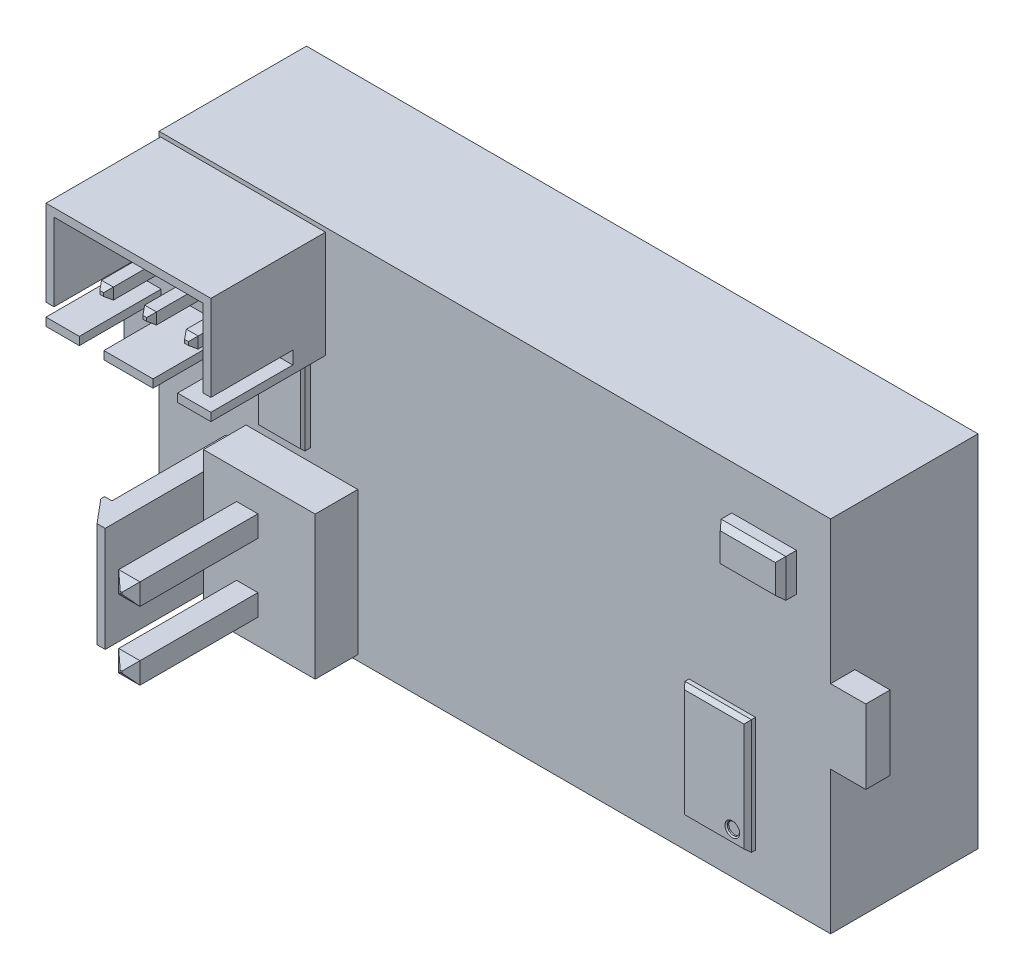
from build123d import *
from OCP.BRepFilletAPI import BRepFilletAPI_MakeChamfer

# Parameters (mm, degrees)
RESSALTO_EXTRUS_O1_DEPTH  = 9
ESBO_O2_W                 = 7.71
ESBO_O2_H                 = 4.52
CORTE_EXTRUS_O1_DEPTH     = 2.15
ESBO_O3_W                 = 7.71
ESBO_O3_H                 = 4.52
CORTE_EXTRUS_O2_DEPTH     = 2.15
RESSALTO_EXTRUS_O2_DEPTH  = 45.3
RESSALTO_EXTRUS_O4_DEPTH  = 2.6
ESBO_O11_W                = 1.3
ESBO_O11_H                = 1.3
RESSALTO_EXTRUS_O5_DEPTH  = 7.7
CHANFRO1_SIZE             = 0.5
CHANFRO1_SIZE2            = 0.595876796
ESBO_O12_W                = 1.247641749
ESBO_O12_H                = 6.404560975
RESSALTO_EXTRUS_O6_DEPTH  = 6
ESBO_O13_W                = 1.65918813
ESBO_O13_H                = 6.404560975
RESSALTO_EXTRUS_O7_DEPTH  = 0.45
CHANFRO2_SIZE             = 1.2
CHANFRO2_SIZE2            = 1.430104311
ESBO_O14_W                = 10.066468689
ESBO_O14_H                = 6.518451036
RESSALTO_EXTRUS_O8_DEPTH  = 2
ESBO_O15_W                = 10.066468689
ESBO_O15_H                = 6.518451036
ESBO_O15_W_2              = 9.090887041
ESBO_O15_H_2              = 5.530006866
RESSALTO_EXTRUS_O9_DEPTH  = 5
ESBO_O16_W                = 0.487790824
ESBO_O16_H                = 0.786498023
CORTE_EXTRUS_O3_DEPTH     = 5
ESBO_O17_W                = 1.5
ESBO_O17_H                = 0.494222085
CORTE_EXTRUS_O4_DEPTH     = 5
ESBO_O19_W                = 0.72
ESBO_O19_H                = 0.693974063
ESBO_O19_W_2              = 0.722477419
ESBO_O19_H_2              = 0.691394518
RESSALTO_EXTRUS_O10_DEPTH = 4
CHANFRO3_SIZE             = 0.35
CHANFRO3_SIZE2            = 0.245072638
ESBO_O20_W                = 4.059987293
ESBO_O20_H                = 7.020394696
RESSALTO_EXTRUS_O13_DEPTH = 0.5
CHANFRO5_SIZE             = 0.25
CHANFRO5_SIZE2            = 0.209774908
ESBO_O21_R                = 0.36689919
CORTE_EXTRUS_O5_DEPTH     = 0.15
CHANFRO6_SIZE             = 0.08
CHANFRO6_SIZE2            = 0.06712797
ESBO_O22_W                = 3.950865536
ESBO_O22_H                = 2.32199992
RESSALTO_EXTRUS_O14_DEPTH = 1
CHANFRO7_SIZE             = 0.35
CHANFRO7_SIZE2            = 0.293684871
ESBO_O23_W                = 2.819161313
ESBO_O23_H                = 4.881962274
RESSALTO_EXTRUS_O15_DEPTH = 0.5
CHANFRO8_SIZE             = 0.15
CHANFRO8_SIZE2            = 0.125864945
ESBO_O24_R                = 0.225
CORTE_EXTRUS_O6_DEPTH     = 0.1
FILETE1_R                 = 0.04
RESSALTO_EXTRUS_O16_DEPTH = 0.1
ESBO_O27_R                = 0.44
RESSALTO_EXTRUS_O17_DEPTH = 0.1
RESSALTO_EXTRUS_O18_DEPTH = 0.1
RESSALTO_EXTRUS_O19_DEPTH = 0.1
RESSALTO_EXTRUS_O20_DEPTH = 0.1
RESSALTO_EXTRUS_O22_DEPTH = 0.1
RESSALTO_EXTRUS_O23_DEPTH = 0.1
RESSALTO_EXTRUS_O24_DEPTH = 0.1
RESSALTO_EXTRUS_O25_DEPTH = 0.1


# Read off the part's stored shape, not the designer's step: Ressalto-extrusão16
with BuildPart() as part:
    # Esboço1 → Ressalto-extrusão1 (new body)
    with BuildSketch(Plane.XY):
        Polygon((20.5, 2.26), (20.5, 10.97), (-20.5, 10.97), (-20.5, 2.26), (-22.65, 2.26), (-22.65, -2.26), (-20.5, -2.26), (-20.5, -10.97), (20.5, -10.97), (20.5, -2.26), (22.65, -2.26), (22.65, 2.26), align=None)
    extrude(amount=RESSALTO_EXTRUS_O1_DEPTH)

    # Esboço2 → Corte-extrusão1 (cut)
    with BuildSketch(Plane(origin=(22.65, 0, 0), x_dir=(0, 0, -1), z_dir=(1, 0, 0))):
        with Locations((-3.855, 0)):
            Rectangle(ESBO_O2_W, ESBO_O2_H)
    extrude(amount=-CORTE_EXTRUS_O1_DEPTH, mode=Mode.SUBTRACT)

    # Esboço3 → Corte-extrusão2 (cut)
    with BuildSketch(Plane.ZY.offset(22.65)):
        with Locations((3.855, 0)):
            Rectangle(ESBO_O3_W, ESBO_O3_H)
    extrude(amount=-CORTE_EXTRUS_O2_DEPTH, mode=Mode.SUBTRACT)

    # Esboço4 → Ressalto-extrusão2 (add)
    with BuildSketch(Plane(origin=(22.65, 0, 0), x_dir=(0, 0, -1), z_dir=(1, 0, 0))):
        Polygon((-7.71, 2.26), (-7.514247248, 2.26), (-7.514247248, -2.254762837), (-7.514247248, -2.26), (-7.71, -2.26), align=None)
    extrude(amount=-RESSALTO_EXTRUS_O2_DEPTH)

    # Esboço9 → Ressalto-extrusão4 (add)
    with BuildSketch(Plane.XY.offset(9)):
        Polygon((-15.187431862, -3.070040694), (-15.187431862, -1.905575063), (-8.366990305, -1.905575063), (-8.366990305, -10.6390673), (-15.187431862, -10.6390673), (-15.187431862, -9.474601669), (-16.435073611, -9.474601669), (-16.435073611, -3.070040694), align=None)
    extrude(amount=RESSALTO_EXTRUS_O4_DEPTH)

    # Esboço11 → Ressalto-extrusão5 (add)
    with BuildSketch(Plane.XY.offset(11.6)):
        with Locations((-12.515679455, -4.290464301)):
            Rectangle(ESBO_O11_W, ESBO_O11_H)
        with Locations((-12.515679455, -8.45811136)):
            Rectangle(ESBO_O11_W, ESBO_O11_H)
    extrude(amount=RESSALTO_EXTRUS_O5_DEPTH)

    # Chanfro1: one chamfer whose edges measure the first distance from different faces: ONE call of the kernel's chamfer builder (chamfer() names one face for all edges)
    chanfro1_edges_1 = [part.edges().sort_by_distance(p)[0] for p in [
        (-11.865679455, -4.290464301, 19.3),
    ]]
    chanfro1_side_1 = [part.faces().sort_by_distance(p)[0] for p in [
        (-11.865679455, -4.290464301, 15.45),
    ]]
    chanfro1_edges_2 = [part.edges().sort_by_distance(p)[0] for p in [
        (-12.515679455, -3.640464301, 19.3),
    ]]
    chanfro1_side_2 = [part.faces().sort_by_distance(p)[0] for p in [
        (-12.515679455, -3.640464301, 15.45),
    ]]
    chanfro1_edges_3 = [part.edges().sort_by_distance(p)[0] for p in [
        (-13.165679455, -4.290464301, 19.3),
    ]]
    chanfro1_side_3 = [part.faces().sort_by_distance(p)[0] for p in [
        (-13.165679455, -4.290464301, 15.45),
    ]]
    chanfro1_edges_4 = [part.edges().sort_by_distance(p)[0] for p in [
        (-12.515679455, -4.940464301, 19.3),
    ]]
    chanfro1_side_4 = [part.faces().sort_by_distance(p)[0] for p in [
        (-12.515679455, -4.940464301, 15.45),
    ]]
    chanfro1_edges_5 = [part.edges().sort_by_distance(p)[0] for p in [
        (-11.865679455, -8.45811136, 19.3),
    ]]
    chanfro1_side_5 = [part.faces().sort_by_distance(p)[0] for p in [
        (-11.865679455, -8.45811136, 15.45),
    ]]
    chanfro1_edges_6 = [part.edges().sort_by_distance(p)[0] for p in [
        (-12.515679455, -7.80811136, 19.3),
    ]]
    chanfro1_side_6 = [part.faces().sort_by_distance(p)[0] for p in [
        (-12.515679455, -7.80811136, 15.45),
    ]]
    chanfro1_edges_7 = [part.edges().sort_by_distance(p)[0] for p in [
        (-13.165679455, -8.45811136, 19.3),
    ]]
    chanfro1_side_7 = [part.faces().sort_by_distance(p)[0] for p in [
        (-13.165679455, -8.45811136, 15.45),
    ]]
    chanfro1_edges_8 = [part.edges().sort_by_distance(p)[0] for p in [
        (-12.515679455, -9.10811136, 19.3),
    ]]
    chanfro1_side_8 = [part.faces().sort_by_distance(p)[0] for p in [
        (-12.515679455, -9.10811136, 15.45),
    ]]
    chanfro1 = BRepFilletAPI_MakeChamfer(part.part.solid().wrapped)
    for e in chanfro1_edges_1:
        chanfro1.Add(CHANFRO1_SIZE, CHANFRO1_SIZE2, e.wrapped, chanfro1_side_1[0].wrapped)  # the first distance lies on this face
    for e in chanfro1_edges_2:
        chanfro1.Add(CHANFRO1_SIZE, CHANFRO1_SIZE2, e.wrapped, chanfro1_side_2[0].wrapped)  # the first distance lies on this face
    for e in chanfro1_edges_3:
        chanfro1.Add(CHANFRO1_SIZE, CHANFRO1_SIZE2, e.wrapped, chanfro1_side_3[0].wrapped)  # the first distance lies on this face
    for e in chanfro1_edges_4:
        chanfro1.Add(CHANFRO1_SIZE, CHANFRO1_SIZE2, e.wrapped, chanfro1_side_4[0].wrapped)  # the first distance lies on this face
    for e in chanfro1_edges_5:
        chanfro1.Add(CHANFRO1_SIZE, CHANFRO1_SIZE2, e.wrapped, chanfro1_side_5[0].wrapped)  # the first distance lies on this face
    for e in chanfro1_edges_6:
        chanfro1.Add(CHANFRO1_SIZE, CHANFRO1_SIZE2, e.wrapped, chanfro1_side_6[0].wrapped)  # the first distance lies on this face
    for e in chanfro1_edges_7:
        chanfro1.Add(CHANFRO1_SIZE, CHANFRO1_SIZE2, e.wrapped, chanfro1_side_7[0].wrapped)  # the first distance lies on this face
    for e in chanfro1_edges_8:
        chanfro1.Add(CHANFRO1_SIZE, CHANFRO1_SIZE2, e.wrapped, chanfro1_side_8[0].wrapped)  # the first distance lies on this face
    add(Compound.cast(chanfro1.Shape()), mode=Mode.REPLACE)

    # Esboço12 → Ressalto-extrusão6 (add)
    with BuildSketch(Plane.XY.offset(11.6)):
        with Locations((-15.811252737, -6.272321182)):
            Rectangle(ESBO_O12_W, ESBO_O12_H)
    extrude(amount=RESSALTO_EXTRUS_O6_DEPTH)

    # Esboço13 → Ressalto-extrusão7 (add)
    with BuildSketch(Plane.ZY.offset(16.435073611)):
        with Locations((16.770405935, -6.272321182)):
            Rectangle(ESBO_O13_W, ESBO_O13_H)
    extrude(amount=RESSALTO_EXTRUS_O7_DEPTH)

    # Chanfro2
    chanfro2_edges = [part.edges().sort_by_distance(p)[0] for p in [
        (-16.885073611, -6.272321182, 17.6),
    ]]
    chanfro2_side = [part.faces().sort_by_distance(p)[0] for p in [
        (-16.036252737, -6.272321182, 17.6),
    ]]
    chamfer(chanfro2_edges, length=CHANFRO2_SIZE, length2=CHANFRO2_SIZE2, reference=chanfro2_side[0])

    # Esboço14 → Ressalto-extrusão8 (add)
    with BuildSketch(Plane.XY.offset(9)):
        with Locations((-15.368835147, 7.455571209)):
            Rectangle(ESBO_O14_W, ESBO_O14_H)
    extrude(amount=RESSALTO_EXTRUS_O8_DEPTH)

    # Esboço15 → Ressalto-extrusão9 (add)
    with BuildSketch(Plane.XY.offset(11)):
        with Locations((-15.368835147, 7.455571209)):
            Rectangle(ESBO_O15_W, ESBO_O15_H)
        with Locations((-15.368835147, 7.455571209)):
            Rectangle(ESBO_O15_W_2, ESBO_O15_H_2, mode=Mode.SUBTRACT)
    extrude(amount=RESSALTO_EXTRUS_O9_DEPTH)

    # Esboço16 → Corte-extrusão3 (cut)
    with BuildSketch(Plane.XY.offset(11)):
        with Locations((-20.158174079, 5.083816787)):
            Rectangle(ESBO_O16_W, ESBO_O16_H)
        with Locations((-10.579496214, 5.083816787)):
            Rectangle(ESBO_O16_W, ESBO_O16_H)
    extrude(amount=CORTE_EXTRUS_O3_DEPTH, mode=Mode.SUBTRACT)

    # Esboço17 → Corte-extrusão4 (cut)
    with BuildSketch(Plane.XY.offset(11)):
        with Locations((-13.118835147, 4.443456733)):
            Rectangle(ESBO_O17_W, ESBO_O17_H)
        with Locations((-17.618835147, 4.443456733)):
            Rectangle(ESBO_O17_W, ESBO_O17_H)
    extrude(amount=CORTE_EXTRUS_O4_DEPTH, mode=Mode.SUBTRACT)

    # Esboço19 → Ressalto-extrusão10 (add)
    with BuildSketch(Plane.XY.offset(11)):
        with Locations((-15.368835147, 6.639450457)):
            Rectangle(ESBO_O19_W, ESBO_O19_H)
        with Locations((-12.823391626, 6.639450457)):
            Rectangle(ESBO_O19_W, ESBO_O19_H)
        with Locations((-18.001110378, 6.639450457)):
            Rectangle(ESBO_O19_W_2, ESBO_O19_H_2)
    extrude(amount=RESSALTO_EXTRUS_O10_DEPTH)

    # Chanfro3: one chamfer whose edges measure the first distance from different faces: ONE call of the kernel's chamfer builder (chamfer() names one face for all edges)
    chanfro3_edges_1 = [part.edges().sort_by_distance(p)[0] for p in [
        (-15.008835147, 6.639450457, 15),
    ]]
    chanfro3_side_1 = [part.faces().sort_by_distance(p)[0] for p in [
        (-15.008835147, 6.639450457, 13),
    ]]
    chanfro3_edges_2 = [part.edges().sort_by_distance(p)[0] for p in [
        (-15.368835147, 6.986437488, 15),
    ]]
    chanfro3_side_2 = [part.faces().sort_by_distance(p)[0] for p in [
        (-15.368835147, 6.986437488, 13),
    ]]
    chanfro3_edges_3 = [part.edges().sort_by_distance(p)[0] for p in [
        (-15.728835147, 6.639450457, 15),
    ]]
    chanfro3_side_3 = [part.faces().sort_by_distance(p)[0] for p in [
        (-15.728835147, 6.639450457, 13),
    ]]
    chanfro3_edges_4 = [part.edges().sort_by_distance(p)[0] for p in [
        (-15.368835147, 6.292463425, 15),
    ]]
    chanfro3_side_4 = [part.faces().sort_by_distance(p)[0] for p in [
        (-15.368835147, 6.292463425, 13),
    ]]
    chanfro3_edges_5 = [part.edges().sort_by_distance(p)[0] for p in [
        (-12.463391626, 6.639450457, 15),
    ]]
    chanfro3_side_5 = [part.faces().sort_by_distance(p)[0] for p in [
        (-12.463391626, 6.639450457, 13),
    ]]
    chanfro3_edges_6 = [part.edges().sort_by_distance(p)[0] for p in [
        (-12.823391626, 6.986437488, 15),
    ]]
    chanfro3_side_6 = [part.faces().sort_by_distance(p)[0] for p in [
        (-12.823391626, 6.986437488, 13),
    ]]
    chanfro3_edges_7 = [part.edges().sort_by_distance(p)[0] for p in [
        (-13.183391626, 6.639450457, 15),
    ]]
    chanfro3_side_7 = [part.faces().sort_by_distance(p)[0] for p in [
        (-13.183391626, 6.639450457, 13),
    ]]
    chanfro3_edges_8 = [part.edges().sort_by_distance(p)[0] for p in [
        (-12.823391626, 6.292463425, 15),
    ]]
    chanfro3_side_8 = [part.faces().sort_by_distance(p)[0] for p in [
        (-12.823391626, 6.292463425, 13),
    ]]
    chanfro3_edges_9 = [part.edges().sort_by_distance(p)[0] for p in [
        (-17.639871668, 6.639450457, 15),
    ]]
    chanfro3_side_9 = [part.faces().sort_by_distance(p)[0] for p in [
        (-17.639871668, 6.639450457, 13),
    ]]
    chanfro3_edges_10 = [part.edges().sort_by_distance(p)[0] for p in [
        (-18.001110377, 6.985147716, 15),
    ]]
    chanfro3_side_10 = [part.faces().sort_by_distance(p)[0] for p in [
        (-18.001110377, 6.985147716, 13),
    ]]
    chanfro3_edges_11 = [part.edges().sort_by_distance(p)[0] for p in [
        (-18.362349087, 6.639450457, 15),
    ]]
    chanfro3_side_11 = [part.faces().sort_by_distance(p)[0] for p in [
        (-18.362349087, 6.639450457, 13),
    ]]
    chanfro3_edges_12 = [part.edges().sort_by_distance(p)[0] for p in [
        (-18.001110377, 6.293753198, 15),
    ]]
    chanfro3_side_12 = [part.faces().sort_by_distance(p)[0] for p in [
        (-18.001110377, 6.293753198, 13),
    ]]
    chanfro3 = BRepFilletAPI_MakeChamfer(part.part.solid().wrapped)
    for e in chanfro3_edges_1:
        chanfro3.Add(CHANFRO3_SIZE, CHANFRO3_SIZE2, e.wrapped, chanfro3_side_1[0].wrapped)  # the first distance lies on this face
    for e in chanfro3_edges_2:
        chanfro3.Add(CHANFRO3_SIZE, CHANFRO3_SIZE2, e.wrapped, chanfro3_side_2[0].wrapped)  # the first distance lies on this face
    for e in chanfro3_edges_3:
        chanfro3.Add(CHANFRO3_SIZE, CHANFRO3_SIZE2, e.wrapped, chanfro3_side_3[0].wrapped)  # the first distance lies on this face
    for e in chanfro3_edges_4:
        chanfro3.Add(CHANFRO3_SIZE, CHANFRO3_SIZE2, e.wrapped, chanfro3_side_4[0].wrapped)  # the first distance lies on this face
    for e in chanfro3_edges_5:
        chanfro3.Add(CHANFRO3_SIZE, CHANFRO3_SIZE2, e.wrapped, chanfro3_side_5[0].wrapped)  # the first distance lies on this face
    for e in chanfro3_edges_6:
        chanfro3.Add(CHANFRO3_SIZE, CHANFRO3_SIZE2, e.wrapped, chanfro3_side_6[0].wrapped)  # the first distance lies on this face
    for e in chanfro3_edges_7:
        chanfro3.Add(CHANFRO3_SIZE, CHANFRO3_SIZE2, e.wrapped, chanfro3_side_7[0].wrapped)  # the first distance lies on this face
    for e in chanfro3_edges_8:
        chanfro3.Add(CHANFRO3_SIZE, CHANFRO3_SIZE2, e.wrapped, chanfro3_side_8[0].wrapped)  # the first distance lies on this face
    for e in chanfro3_edges_9:
        chanfro3.Add(CHANFRO3_SIZE, CHANFRO3_SIZE2, e.wrapped, chanfro3_side_9[0].wrapped)  # the first distance lies on this face
    for e in chanfro3_edges_10:
        chanfro3.Add(CHANFRO3_SIZE, CHANFRO3_SIZE2, e.wrapped, chanfro3_side_10[0].wrapped)  # the first distance lies on this face
    for e in chanfro3_edges_11:
        chanfro3.Add(CHANFRO3_SIZE, CHANFRO3_SIZE2, e.wrapped, chanfro3_side_11[0].wrapped)  # the first distance lies on this face
    for e in chanfro3_edges_12:
        chanfro3.Add(CHANFRO3_SIZE, CHANFRO3_SIZE2, e.wrapped, chanfro3_side_12[0].wrapped)  # the first distance lies on this face
    add(Compound.cast(chanfro3.Shape()), mode=Mode.REPLACE)

    # Esboço20 → Ressalto-extrusão13 (add)
    with BuildSketch(Plane.XY.offset(9)):
        with Locations((13.888859249, -5.321184169)):
            Rectangle(ESBO_O20_W, ESBO_O20_H)
    extrude(amount=RESSALTO_EXTRUS_O13_DEPTH)

    # Chanfro5: one chamfer whose edges measure the first distance from different faces: ONE call of the kernel's chamfer builder (chamfer() names one face for all edges)
    chanfro5_edges_1 = [part.edges().sort_by_distance(p)[0] for p in [
        (15.918852895, -5.321184169, 9.5),
    ]]
    chanfro5_side_1 = [part.faces().sort_by_distance(p)[0] for p in [
        (15.918852895, -5.321184169, 9.25),
    ]]
    chanfro5_edges_2 = [part.edges().sort_by_distance(p)[0] for p in [
        (13.888859248, -1.810986821, 9.5),
    ]]
    chanfro5_side_2 = [part.faces().sort_by_distance(p)[0] for p in [
        (13.888859248, -1.810986821, 9.25),
    ]]
    chanfro5_edges_3 = [part.edges().sort_by_distance(p)[0] for p in [
        (11.858865602, -5.321184169, 9.5),
    ]]
    chanfro5_side_3 = [part.faces().sort_by_distance(p)[0] for p in [
        (11.858865602, -5.321184169, 9.25),
    ]]
    chanfro5_edges_4 = [part.edges().sort_by_distance(p)[0] for p in [
        (13.888859248, -8.831381517, 9.5),
    ]]
    chanfro5_side_4 = [part.faces().sort_by_distance(p)[0] for p in [
        (13.888859248, -8.831381517, 9.25),
    ]]
    chanfro5 = BRepFilletAPI_MakeChamfer(part.part.solid().wrapped)
    for e in chanfro5_edges_1:
        chanfro5.Add(CHANFRO5_SIZE, CHANFRO5_SIZE2, e.wrapped, chanfro5_side_1[0].wrapped)  # the first distance lies on this face
    for e in chanfro5_edges_2:
        chanfro5.Add(CHANFRO5_SIZE, CHANFRO5_SIZE2, e.wrapped, chanfro5_side_2[0].wrapped)  # the first distance lies on this face
    for e in chanfro5_edges_3:
        chanfro5.Add(CHANFRO5_SIZE, CHANFRO5_SIZE2, e.wrapped, chanfro5_side_3[0].wrapped)  # the first distance lies on this face
    for e in chanfro5_edges_4:
        chanfro5.Add(CHANFRO5_SIZE, CHANFRO5_SIZE2, e.wrapped, chanfro5_side_4[0].wrapped)  # the first distance lies on this face
    add(Compound.cast(chanfro5.Shape()), mode=Mode.REPLACE)

    # Esboço21 → Corte-extrusão5 (cut)
    with BuildSketch(Plane.XY.offset(9.5)):
        with Locations((14.997608626, -7.938356753)):
            Circle(ESBO_O21_R)
    extrude(amount=-CORTE_EXTRUS_O5_DEPTH, mode=Mode.SUBTRACT)

    # Chanfro6
    chanfro6_edges = [part.edges().sort_by_distance(p)[0] for p in [
        (14.630709436, -7.938356753, 9.5),
    ]]
    chanfro6_side = [part.faces().sort_by_distance(p)[0] for p in [
        (13.868996703, -5.274299173, 9.5),
    ]]
    chamfer(chanfro6_edges, length=CHANFRO6_SIZE, length2=CHANFRO6_SIZE2, reference=chanfro6_side[0])

    # Esboço22 → Ressalto-extrusão14 (add)
    with BuildSketch(Plane.XY.offset(9)):
        with Locations((16.44339897, 7.108234286)):
            Rectangle(ESBO_O22_W, ESBO_O22_H)
    extrude(amount=RESSALTO_EXTRUS_O14_DEPTH)

    # Chanfro7: one chamfer whose edges measure the first distance from different faces: ONE call of the kernel's chamfer builder (chamfer() names one face for all edges)
    chanfro7_edges_1 = [part.edges().sort_by_distance(p)[0] for p in [
        (18.418831738, 7.108234286, 10),
    ]]
    chanfro7_side_1 = [part.faces().sort_by_distance(p)[0] for p in [
        (18.418831738, 7.108234286, 9.5),
    ]]
    chanfro7_edges_2 = [part.edges().sort_by_distance(p)[0] for p in [
        (16.44339897, 8.269234246, 10),
    ]]
    chanfro7_side_2 = [part.faces().sort_by_distance(p)[0] for p in [
        (16.44339897, 8.269234246, 9.5),
    ]]
    chanfro7_edges_3 = [part.edges().sort_by_distance(p)[0] for p in [
        (14.467966202, 7.108234286, 10),
    ]]
    chanfro7_side_3 = [part.faces().sort_by_distance(p)[0] for p in [
        (14.467966202, 7.108234286, 9.5),
    ]]
    chanfro7_edges_4 = [part.edges().sort_by_distance(p)[0] for p in [
        (16.44339897, 5.947234326, 10),
    ]]
    chanfro7_side_4 = [part.faces().sort_by_distance(p)[0] for p in [
        (16.44339897, 5.947234326, 9.5),
    ]]
    chanfro7 = BRepFilletAPI_MakeChamfer(part.part.solid().wrapped)
    for e in chanfro7_edges_1:
        chanfro7.Add(CHANFRO7_SIZE, CHANFRO7_SIZE2, e.wrapped, chanfro7_side_1[0].wrapped)  # the first distance lies on this face
    for e in chanfro7_edges_2:
        chanfro7.Add(CHANFRO7_SIZE, CHANFRO7_SIZE2, e.wrapped, chanfro7_side_2[0].wrapped)  # the first distance lies on this face
    for e in chanfro7_edges_3:
        chanfro7.Add(CHANFRO7_SIZE, CHANFRO7_SIZE2, e.wrapped, chanfro7_side_3[0].wrapped)  # the first distance lies on this face
    for e in chanfro7_edges_4:
        chanfro7.Add(CHANFRO7_SIZE, CHANFRO7_SIZE2, e.wrapped, chanfro7_side_4[0].wrapped)  # the first distance lies on this face
    add(Compound.cast(chanfro7.Shape()), mode=Mode.REPLACE)

    # Esboço23 → Ressalto-extrusão15 (add)
    with BuildSketch(Plane.XY.offset(9)):
        with Locations((-12.654694051, 1.306866169)):
            Rectangle(ESBO_O23_W, ESBO_O23_H)
    extrude(amount=RESSALTO_EXTRUS_O15_DEPTH)

    # Chanfro8: one chamfer whose edges measure the first distance from different faces: ONE call of the kernel's chamfer builder (chamfer() names one face for all edges)
    chanfro8_edges_1 = [part.edges().sort_by_distance(p)[0] for p in [
        (-11.245113394, 1.306866169, 9.5),
    ]]
    chanfro8_side_1 = [part.faces().sort_by_distance(p)[0] for p in [
        (-11.245113394, 1.306866169, 9.25),
    ]]
    chanfro8_edges_2 = [part.edges().sort_by_distance(p)[0] for p in [
        (-12.65469405, 3.747847306, 9.5),
    ]]
    chanfro8_side_2 = [part.faces().sort_by_distance(p)[0] for p in [
        (-12.65469405, 3.747847306, 9.25),
    ]]
    chanfro8_edges_3 = [part.edges().sort_by_distance(p)[0] for p in [
        (-14.064274707, 1.306866169, 9.5),
    ]]
    chanfro8_side_3 = [part.faces().sort_by_distance(p)[0] for p in [
        (-14.064274707, 1.306866169, 9.25),
    ]]
    chanfro8_edges_4 = [part.edges().sort_by_distance(p)[0] for p in [
        (-12.65469405, -1.134114968, 9.5),
    ]]
    chanfro8_side_4 = [part.faces().sort_by_distance(p)[0] for p in [
        (-12.65469405, -1.134114968, 9.25),
    ]]
    chanfro8 = BRepFilletAPI_MakeChamfer(part.part.solid().wrapped)
    for e in chanfro8_edges_1:
        chanfro8.Add(CHANFRO8_SIZE, CHANFRO8_SIZE2, e.wrapped, chanfro8_side_1[0].wrapped)  # the first distance lies on this face
    for e in chanfro8_edges_2:
        chanfro8.Add(CHANFRO8_SIZE, CHANFRO8_SIZE2, e.wrapped, chanfro8_side_2[0].wrapped)  # the first distance lies on this face
    for e in chanfro8_edges_3:
        chanfro8.Add(CHANFRO8_SIZE, CHANFRO8_SIZE2, e.wrapped, chanfro8_side_3[0].wrapped)  # the first distance lies on this face
    for e in chanfro8_edges_4:
        chanfro8.Add(CHANFRO8_SIZE, CHANFRO8_SIZE2, e.wrapped, chanfro8_side_4[0].wrapped)  # the first distance lies on this face
    add(Compound.cast(chanfro8.Shape()), mode=Mode.REPLACE)

    # Esboço24 → Corte-extrusão6 (cut)
    with BuildSketch(Plane.XY.offset(9.5)):
        with Locations((-11.96606384, 3.000459368)):
            Circle(ESBO_O24_R)
    extrude(amount=-CORTE_EXTRUS_O6_DEPTH, mode=Mode.SUBTRACT)

    # Filete1
    filete1_edges = [part.edges().sort_by_distance(p)[0] for p in [
        (-12.19106384, 3.000459368, 9.5),
    ]]
    fillet(filete1_edges, radius=FILETE1_R)

    # Ressalto-extrusão16 outline → Ressalto-extrusão16 (add)
    with BuildSketch(Plane(origin=(0, 0, 0), x_dir=(-1, 0, 0), z_dir=(0, 0, -1))):
        Polygon((-9.022184982, 5.810541725), (-9.424583686, 5.342450449), (-9.424583686, 5.224404384), (-9.133464362, 4.933285061), (-6.648000063, 4.933285061), (-6.146974609, 5.322825024), (-6.146974609, 5.544514434), (-6.397487336, 5.75986986), align=None)
        Polygon((-8.90723913, 7.740305004), (-8.884083762, 7.883779663), (-8.904666609, 7.909732389), (-9.223487961, 8.351699209), (-9.291335623, 8.351699209), (-9.601672133, 8.080191243), (-9.960281289, 5.953267973), (-9.696946249, 5.479675032), (-9.601672133, 5.479675032), (-9.223487961, 5.810541725), align=None)
        Polygon((-10.155073564, 4.797948274), (-10.541819118, 2.504147056), (-10.386663777, 2.288383587), (-9.698928717, 2.788410627), (-9.698928717, 2.909382825), (-9.38943137, 4.797948274), (-9.696946249, 5.256075588), align=None)
        Polygon((-8.904666609, 8.679940182), (-9.0403923, 8.599956963), (-9.068812034, 8.395334877), (-8.722091278, 7.958620513), (-6.076120938, 7.958620513), (-5.565523869, 8.469217582), (-5.565523869, 8.679940182), align=None)
        Polygon((-6.862278331, 2.909382825), (-6.521880285, 2.441335511), (-6.146974609, 2.601163274), (-5.757670698, 4.88693338), (-6.076120938, 5.211121996), (-6.521880285, 4.88693338), align=None)
        Polygon((-10.103698733, 2.017864132), (-6.807458051, 2.017864132), (-6.716398324, 2.081520482), (-6.648000063, 2.349925377), (-6.985441524, 2.853176054), (-9.407158963, 2.853176054), (-10.140496619, 2.288383587), (-10.167355083, 2.081520482), align=None)
    extrude(amount=RESSALTO_EXTRUS_O16_DEPTH)

    # Esboço27 → Ressalto-extrusão17 (add)
    with BuildSketch(Plane(origin=(0, 0, 0), x_dir=(-1, 0, 0), z_dir=(0, 0, -1))):
        Polygon((-1.820893109, 7.882254964), (-2.213635048, 8.336469555), (-2.118010924, 8.575529866), (-1.881423651, 8.676924412), (1.240786444, 8.676924412), (1.335468459, 8.455999711), (0.834383916, 7.882254964), align=None)
        Polygon((-1.870462771, 7.663919547), (-2.352890946, 8.259259949), (-2.603527947, 8.098916308), (-3.064123888, 5.878607668), (-2.833825918, 5.42870207), (-2.767827657, 5.396158014), (-2.274788426, 5.714862545), align=None)
        Polygon((-2.833825918, 5.10940604), (-2.695184574, 5.10940604), (-2.405978911, 4.702954838), (-2.764505246, 2.827026214), (-3.328310485, 2.311145842), (-3.453372393, 2.311145842), (-3.743911126, 2.601684575), (-3.297104064, 4.755523743), align=None)
        Polygon((-1.909973877, 5.76320508), (0.391805309, 5.7619753), (0.689419373, 5.396158014), (0.689419373, 5.221781178), (0.218918549, 4.839000846), (-2.332671103, 4.893567755), (-2.554926715, 5.221781178), (-2.554926715, 5.326463687), align=None)
        Polygon((0.326755387, 2.311145842), (0, 2.688470515), (-2.695184574, 2.701964306), (-3.288749165, 2.187949608), (-3.288749165, 1.935960117), (-3.074278484, 1.834347317), (0.218918549, 1.834347317), (0.326755387, 2.061954863), align=None)
        Polygon((4.902981027, 8.336469555), (5.288496702, 7.882254964), (7.750388964, 7.841320368), (8.529978555, 8.455999711), (8.529978555, 8.598698492), (8.444906284, 8.698930647), (5.000182376, 8.698930647), (4.854791568, 8.575529866), (4.854791568, 8.38839815), align=None)
        Polygon((4.377699133, 5.221781178), (4.644361984, 4.879242839), (4.26750828, 2.769740339), (3.71772419, 2.263332914), (3.483035054, 2.311145842), (3.330134762, 2.542286277), (3.789355095, 4.978143743), (4.26750828, 5.221781178), align=None)
        Polygon((3.799496306, 2.187949608), (4.459774797, 2.766152435), (6.893805749, 2.766152435), (7.39662527, 2.263332914), (7.39662527, 2.124952236), (7.253925905, 1.98225287), (3.947258274, 1.935960117), (3.799496306, 2.061954863), align=None)
        Polygon((7.433843854, 4.978143743), (7.815181056, 5.260788883), (7.974483339, 5.260788883), (8.204425201, 4.950557523), (8.260532519, 4.839000846), (7.894832197, 2.378635215), (7.749022617, 2.263332914), (7.605903163, 2.263332914), (7.080990849, 2.827026214), align=None)
        Polygon((7.974483339, 5.396158014), (8.385565054, 5.680197132), (8.745075189, 8.098916308), (8.62622932, 8.259259949), (8.529978555, 8.259259949), (7.894832197, 7.788492789), (7.562417638, 5.7619753), (7.815181056, 5.396158014), align=None)
        with Locations(Location((-3.227580078, 8.259259949, 0), (0, 0, 180))):
            Circle(ESBO_O27_R)
        Polygon((4.793390983, 5.71345793), (5.155429658, 7.740030791), (4.764295037, 8.259259949), (4.616533069, 8.259259949), (4.377699133, 8.098916308), (3.947258274, 5.815714751), (4.26750828, 5.396158014), (4.377699133, 5.396158014), align=None)
    extrude(amount=RESSALTO_EXTRUS_O17_DEPTH)

    # Esboço28 → Ressalto-extrusão18 (add)
    with BuildSketch(Plane(origin=(0, 0, 0), x_dir=(-1, 0, 0), z_dir=(0, 0, -1))):
        Polygon((-9.125044696, -2.349035316), (-8.682095913, -2.972444714), (-6.024403214, -2.972444714), (-5.400993815, -2.349035316), (-5.400993815, -2.184980211), (-5.597859941, -1.988114085), (-8.903570305, -1.988114085), align=None)
        Polygon((-9.671923102, -2.73898635), (-10.08644048, -5.151341584), (-9.755792495, -5.481989569), (-9.650021032, -5.481989569), (-9.102202806, -5.00734778), (-8.7807273, -3.136465741), (-9.232015842, -2.497907805), (-9.341413089, -2.497907805), align=None)
        Polygon((-10.650757172, -8.435479707), (-10.430536465, -8.747084517), (-9.650021032, -8.195470244), (-9.293577196, -6.121083986), (-9.650021032, -5.65691868), (-9.755792495, -5.65691868), (-10.236782453, -6.026282576), align=None)
        Polygon((-8.995783549, -5.151341584), (-9.502998785, -5.561481975), (-9.125044696, -6.028892833), (-6.664107542, -6.028892833), (-6.262424787, -5.704087285), (-6.141068514, -5.605957132), (-6.141068514, -5.425215195), (-6.433444451, -5.063637714), (-8.887321325, -5.063637714), align=None)
        Polygon((-6.859649174, -8.137610992), (-6.482733937, -8.603212167), (-6.482733937, -8.824927012), (-6.78335497, -9.068286895), (-9.934095026, -9.1279373), (-10.236782453, -8.876660476), (-10.236782453, -8.747084517), (-9.341413089, -8.137610992), align=None)
    extrude(amount=RESSALTO_EXTRUS_O18_DEPTH)

    # Esboço29 → Ressalto-extrusão19 (add)
    with BuildSketch(Plane(origin=(0, 0, 0), x_dir=(-1, 0, 0), z_dir=(0, 0, -1))):
        Polygon((-1.970760555, -2.008159211), (-2.203872346, -2.363961418), (-2.203872346, -2.462113751), (-1.731514243, -2.934471854), (0.826580938, -2.934471854), (1.427763978, -2.413037585), (1.525916311, -2.186060314), (1.371614334, -2.008159211), (-1.967693294, -2.008159211), align=None)
        Polygon((1.685413853, -2.413037585), (1.930794685, -2.658418417), (1.685413853, -5.063150578), (1.157845062, -5.369876619), (0.998347521, -5.369876619), (0.708978653, -4.963514333), (0.708978653, -4.872162166), (0.888921861, -3.108718732), align=None)
        Polygon((0.57311861, -5.063150578), (0.939437139, -5.52937416), (0.939437139, -5.72834936), (0.495316814, -6.077301045), (-2.103746129, -6.077301045), (-2.486060303, -5.590719368), (-2.486060303, -5.468028952), (-1.970760555, -5.063150578), (0.495316814, -5.063150578), align=None)
        Polygon((-2.608825682, -5.661390805), (-2.772355034, -5.661390805), (-3.240387316, -5.982810565), (-3.688781802, -8.39724241), (-3.464584559, -8.723705062), (-3.321488853, -8.723705062), (-2.548454655, -8.018665373), (-2.203872346, -6.187206105), (-2.203872346, -6.11537196), align=None)
        Polygon((-3.168631356, -8.812068836), (-2.968055695, -9.012644498), (0.368186142, -9.012644498), (0.635620357, -8.745210282), (0.635620357, -8.544634621), (0.194353902, -8.103368166), (-2.414118512, -8.103368166), align=None)
    extrude(amount=RESSALTO_EXTRUS_O19_DEPTH)

    # Esboço30 → Ressalto-extrusão20 (add)
    with BuildSketch(Plane(origin=(0, 0, 0), x_dir=(-1, 0, 0), z_dir=(0, 0, -1))):
        Polygon((8.26636883, -1.758791599), (5.09431079, -1.758791599), (4.98462815, -1.863942319), (4.658544627, -2.190025842), (4.658544627, -2.31453046), (5.09431079, -2.750296623), (7.73558733, -2.750296623), (8.470757455, -2.190025842), (8.470757455, -2.02698408), align=None)
        Polygon((7.830447991, -2.907409594), (7.505885236, -4.662331829), (7.975787962, -5.239889106), (8.079457227, -5.239889106), (8.403053701, -5.009817625), (8.862057683, -2.527966948), (8.652712789, -2.364131813), (8.52584355, -2.364131813), align=None)
        Polygon((7.33078023, -4.75934911), (7.382929758, -4.823609222), (7.830447991, -5.386323247), (7.830447991, -5.473409942), (7.382929758, -5.829314646), (4.806447607, -5.829314646), (4.378787058, -5.357316957), (4.378787058, -5.187009659), (4.806447607, -4.75934911), align=None)
        Polygon((4.228100082, -5.386323247), (4.101850518, -5.386323247), (3.66320233, -5.646481609), (3.190048521, -8.119024234), (3.434372861, -8.414360861), (3.556183811, -8.414360861), (4.248642439, -7.847925409), (4.27018327, -7.722228934), (4.594575389, -5.829314646), align=None)
        Polygon((6.941346118, -7.847925409), (4.523188636, -7.847925409), (3.59891511, -8.558188997), (3.59891511, -8.697904762), (3.832670333, -8.931659986), (7.064940833, -8.931659986), (7.382929758, -8.613671061), (7.382929758, -8.375483765), align=None)
    extrude(amount=RESSALTO_EXTRUS_O20_DEPTH)

    # Esboço31 → Ressalto-extrusão22 (add)
    with BuildSketch(Plane(origin=(0, 0, 0), x_dir=(-1, 0, 0), z_dir=(0, 0, -1))):
        Polygon((-15.87640751, 6.853199261), (-14.810187015, 4.076803319), (-14.319303322, 4.076803319), (-13.200299635, 6.853199261), (-13.717574924, 6.853199261), (-14.00267548, 6.107141733), (-15.100798675, 6.107141733), (-15.343297263, 6.853199261), align=None)
        Polygon((-14.564745169, 4.636305163), (-14.94215055, 5.61905383), (-14.189194785, 5.61905383), align=None, mode=Mode.SUBTRACT)
    extrude(amount=RESSALTO_EXTRUS_O22_DEPTH)

    # Esboço33 → Ressalto-extrusão23 (add)
    with BuildSketch(Plane(origin=(0, 0, 0), x_dir=(-1, 0, 0), z_dir=(0, 0, -1))):
        with BuildLine():
            Line((-16.038114426, 7.251484705), (-16.112674448, 7.616000367))
            ThreePointArc((-16.112674448, 7.616000367), (-15.397836066, 8.057683618), (-14.580051777, 7.864533773))
            ThreePointArc((-14.580051777, 7.864533773), (-13.761973109, 7.695526575), (-13.063997999, 8.154489414))
            Line((-13.063997999, 8.154489414), (-13.063997999, 7.765120411))
            ThreePointArc((-13.063997999, 7.765120411), (-13.759067357, 7.299142468), (-14.580051777, 7.461134561))
            ThreePointArc((-14.580051777, 7.461134561), (-15.349201965, 7.635326361), (-16.038114426, 7.251484705))
        make_face()
    extrude(amount=RESSALTO_EXTRUS_O23_DEPTH)

    # Esboço34 → Ressalto-extrusão24 (add)
    with BuildSketch(Plane(origin=(0, 0, 0), x_dir=(-1, 0, 0), z_dir=(0, 0, -1))):
        with BuildLine():
            Line((-15.990779185, -3.675722545), (-15.990779185, -4.063995678))
            ThreePointArc((-15.990779185, -4.063995678), (-15.240895506, -3.63966112), (-14.410597827, -3.869859112))
            ThreePointArc((-14.410597827, -3.869859112), (-13.630870513, -4.005058268), (-12.983919801, -3.549308036))
            Line((-12.983919801, -3.549308036), (-12.983919801, -3.142975687))
            ThreePointArc((-12.983919801, -3.142975687), (-13.635545745, -3.587438909), (-14.410597827, -3.440952743))
            ThreePointArc((-14.410597827, -3.440952743), (-15.249310924, -3.231071369), (-15.990779185, -3.675722545))
        make_face()
    extrude(amount=RESSALTO_EXTRUS_O24_DEPTH)

    # Esboço35 → Ressalto-extrusão25 (add)
    with BuildSketch(Plane(origin=(0, 0, 0), x_dir=(-1, 0, 0), z_dir=(0, 0, -1))):
        Polygon((-14.686835192, -4.391384886), (-14.231829242, -4.391384886), (-13.161227004, -7.157107332), (-13.696528123, -7.157107332), (-14.459332217, -4.944529375), (-15.275666423, -7.157107332), (-15.837732598, -7.157107332), align=None)
    extrude(amount=RESSALTO_EXTRUS_O25_DEPTH)


solid = part.part
